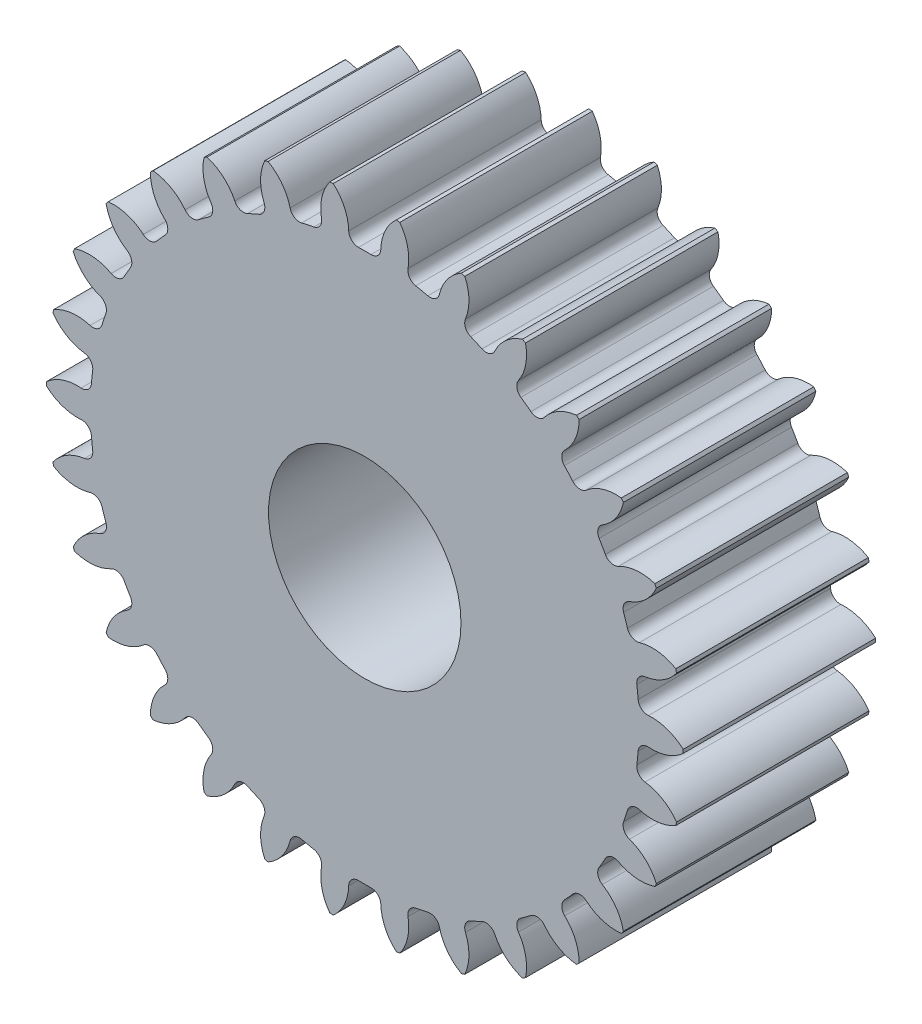
from build123d import *

# Parameters (mm, degrees)
SKETCH1_R                = 6.61650035
SKETCH1_R_2              = 2
BOSS_EXTRUDE1_DEPTH      = 4
CUT_EXTRUDE1_START       = -13
CUT_EXTRUDE1_DEPTH       = 13
FILLET3_R                = 0.2
CIRPATTERN5_COUNT        = 30
FILLET3_OF_CIRPATTERN5_R = 0.2


with BuildPart() as part:
    # Sketch1 → Boss-Extrude1 (new body)
    with BuildSketch(Plane.XY):
        Circle(SKETCH1_R)
        Circle(SKETCH1_R_2, mode=Mode.SUBTRACT)
    extrude(amount=BOSS_EXTRUDE1_DEPTH)

    # Sketch2 → Cut-Extrude1 (cut)
    with BuildSketch(Plane.XY.offset(4).offset(CUT_EXTRUDE1_START)):
        with BuildLine():
            ThreePointArc((0.349893697, 5.688800266), (0, 5.699550339), (-0.349893697, 5.688800266))
            ThreePointArc((-0.349893697, 5.688800266), (-0.384715887, 6.176524535), (-0.654995745, 6.584000111))
            ThreePointArc((-0.654995745, 6.584000111), (0, 6.61650035), (0.654995745, 6.584000111))
            ThreePointArc((0.654995745, 6.584000111), (0.384715887, 6.176524535), (0.349893697, 5.688800266))
        make_face()
    cut_extrude1 = extrude(amount=CUT_EXTRUDE1_DEPTH, mode=Mode.SUBTRACT)

    # Fillet3
    fillet3_edges = [part.edges().sort_by_distance(p)[0] for p in [
        (0.349893697, 5.688800266, 2),
        (-0.349893697, 5.688800266, 2),
    ]]
    fillet(fillet3_edges, radius=FILLET3_R)

    # CirPattern5: Cut-Extrude1 ×30 about axis
    cirpattern5_axis = Axis((0, 0, 4), (0, 0, 1))
    for i in range(1, CIRPATTERN5_COUNT):
        add(cut_extrude1.rotate(cirpattern5_axis, i * 360 / CIRPATTERN5_COUNT), mode=Mode.SUBTRACT)

    # Fillet3 of CirPattern5
    fillet3_of_cirpattern5_edges = [part.edges().sort_by_distance(p)[0] for p in [
        (-0.840520402, 5.637233322, 2),
        (-1.525015762, 5.491739341, 2),
        (-1.994199726, 5.33929223, 2),
        (-2.633487321, 5.054663055, 2),
        (-3.060722953, 4.807998448, 2),
        (-3.626862847, 4.396673738, 2),
        (-3.993477899, 4.066572062, 2),
        (-4.461727063, 3.546528681, 2),
        (-4.751698699, 3.147416963, 2),
        (-5.101592396, 2.541383303, 2),
        (-5.302247465, 2.09070464, 2),
        (-5.518493662, 1.425167279, 2),
        (-5.621062573, 0.942618492, 2),
        (-5.694210274, 0.246664607, 2),
        (-5.694210274, -0.246664607, 2),
        (-5.621062573, -0.942618492, 2),
        (-5.518493662, -1.425167279, 2),
        (-5.302247465, -2.09070464, 2),
        (-5.101592396, -2.541383303, 2),
        (-4.751698699, -3.147416963, 2),
        (-4.461727063, -3.546528681, 2),
        (-3.993477899, -4.066572062, 2),
        (-3.626862847, -4.396673738, 2),
        (-3.060722953, -4.807998448, 2),
        (-2.633487321, -5.054663055, 2),
        (-1.994199726, -5.33929223, 2),
        (-1.525015762, -5.491739341, 2),
        (-0.840520402, -5.637233322, 2),
        (-0.349893697, -5.688800266, 2),
        (0.349893697, -5.688800266, 2),
        (0.840520402, -5.637233322, 2),
        (1.525015762, -5.491739341, 2),
        (1.994199726, -5.33929223, 2),
        (2.633487321, -5.054663055, 2),
        (3.060722953, -4.807998448, 2),
        (3.626862847, -4.396673738, 2),
        (3.993477899, -4.066572062, 2),
        (4.461727063, -3.546528681, 2),
        (4.751698699, -3.147416963, 2),
        (5.101592396, -2.541383303, 2),
        (5.302247465, -2.09070464, 2),
        (5.518493662, -1.425167279, 2),
        (5.621062573, -0.942618492, 2),
        (5.694210274, -0.246664607, 2),
        (5.694210274, 0.246664607, 2),
        (5.621062573, 0.942618492, 2),
        (5.518493662, 1.425167279, 2),
        (5.302247465, 2.09070464, 2),
        (5.101592396, 2.541383303, 2),
        (4.751698699, 3.147416963, 2),
        (4.461727063, 3.546528681, 2),
        (3.993477899, 4.066572062, 2),
        (3.626862847, 4.396673738, 2),
        (3.060722953, 4.807998448, 2),
        (2.633487321, 5.054663055, 2),
        (1.994199726, 5.33929223, 2),
        (1.525015762, 5.491739341, 2),
        (0.840520402, 5.637233322, 2),
    ]]
    fillet(fillet3_of_cirpattern5_edges, radius=FILLET3_OF_CIRPATTERN5_R)


solid = part.part
